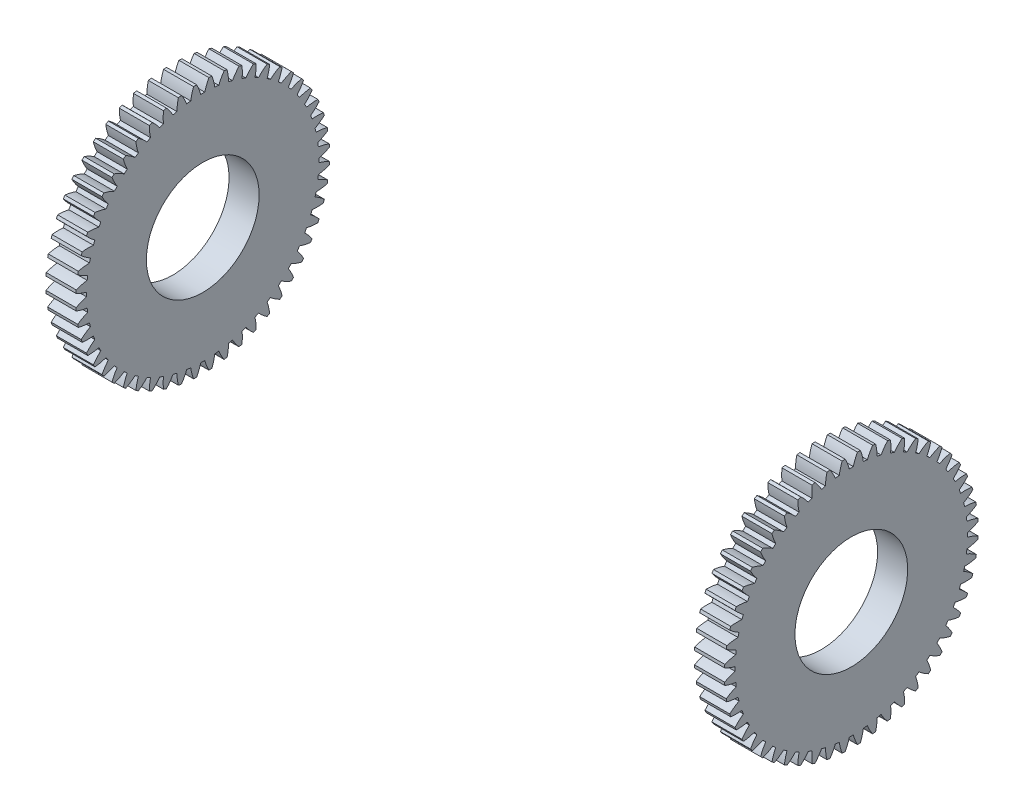
from build123d import *

# Parameters (mm, degrees)
BASPROSKE_W     = 5.08
BASPROSKE_H     = 21.43125
TOOTHCUT_DEPTH  = 65.848483773
TEETHCUTS_COUNT = 52
TEETHCUTS_ANGLE = 353.076923077
BORSKE_R        = 9.525
BORE_DEPTH      = 50.8000508


with BuildPart() as part:
    # BasProSke → Base-Revolve (revolve)
    with BuildSketch(Plane(origin=(0, 0, 0), x_dir=(1, 0, 0), z_dir=(0, 1, 0))):
        with Locations((54.789999952, 10.715625)):
            Rectangle(BASPROSKE_W, BASPROSKE_H)
    revolve(axis=Axis((-10, 0, 0), (1, 0, 0)))

    # TooCutSke → ToothCut (cut, through all)
    with BuildSketch(Plane(origin=(0, 0, 0), x_dir=(0, 0, -1), z_dir=(1, 0, 0))):
        with BuildLine():
            ThreePointArc((0.340444385, 19.631248235), (0, 19.6342), (-0.340444385, 19.631248235))
            ThreePointArc((-0.340444385, 19.631248235), (-0.64320584, 20.551967762), (-1.051795873, 21.430855201))
            ThreePointArc((-1.051795873, 21.430855201), (0, 21.45665), (1.051795873, 21.430855201))
            ThreePointArc((1.051795873, 21.430855201), (0.64320584, 20.551967762), (0.340444385, 19.631248235))
        make_face()
    toothcut = extrude(amount=TOOTHCUT_DEPTH, mode=Mode.SUBTRACT)

    # TeethCuts: ToothCut ×52 about axis
    teethcuts_axis = Axis((-10, 0, 0), (1, 0, 0))
    for i in range(1, TEETHCUTS_COUNT):
        add(toothcut.rotate(teethcuts_axis, i * TEETHCUTS_ANGLE / (TEETHCUTS_COUNT - 1)), mode=Mode.SUBTRACT)

    # BorSke → Bore (cut, symmetric)
    with BuildSketch(Plane(origin=(52.249999952, 0, 0), x_dir=(0, 0, -1), z_dir=(1, 0, 0))):
        Circle(BORSKE_R)
    extrude(amount=BORE_DEPTH, both=True, mode=Mode.SUBTRACT)


with BuildPart() as body_2:
    # Mirror1: mirrored copy
    add(part.part.mirror(Plane(origin=(0, 0, 0), x_dir=(0, 0, 1), z_dir=(1, 0, 0))))


solid = Compound([part.part, body_2.part])
